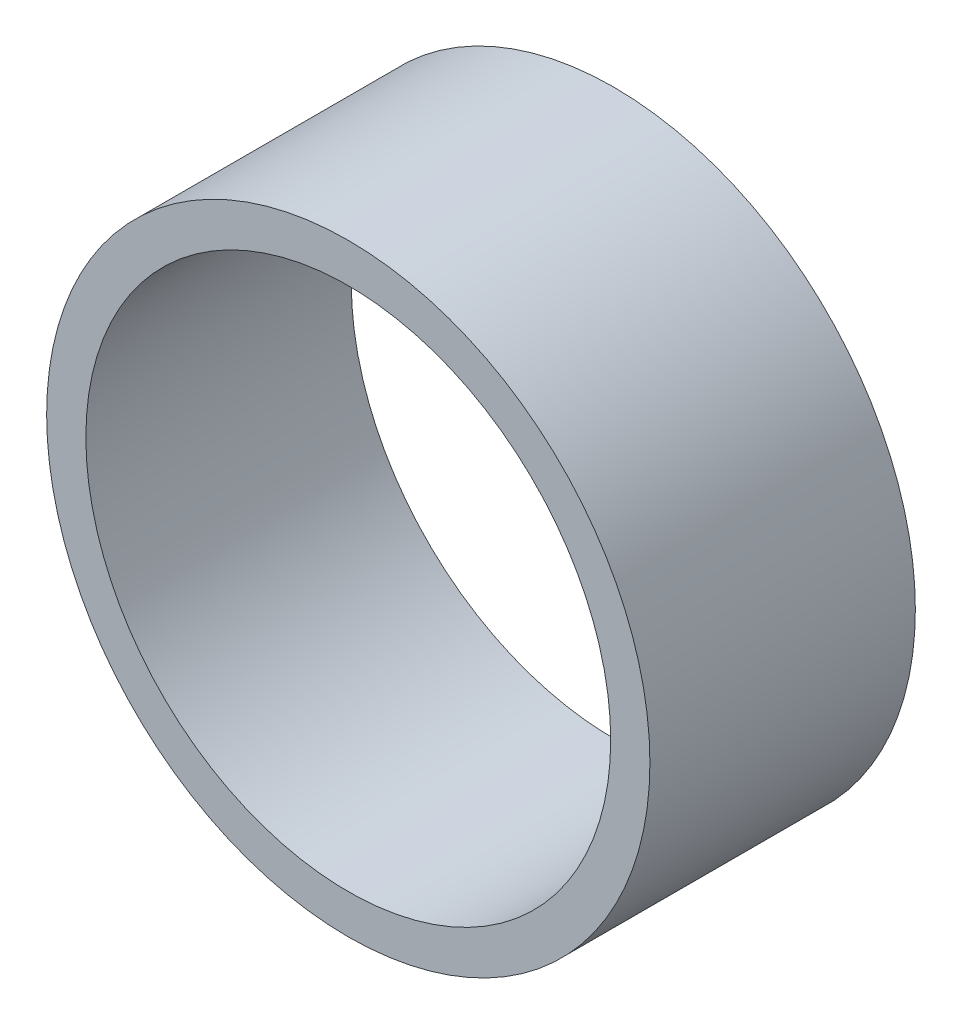
from build123d import *

# Parameters (mm, degrees)
SKETCH1_R           = 25
SKETCH1_R_2         = 21.75
BOSS_EXTRUDE1_DEPTH = 11


with BuildPart() as part:
    # Sketch1 → Boss-Extrude1 (new, symmetric)
    with BuildSketch(Plane.XY):
        Circle(SKETCH1_R)
        Circle(SKETCH1_R_2, mode=Mode.SUBTRACT)
    extrude(amount=BOSS_EXTRUDE1_DEPTH, both=True)


solid = part.part
